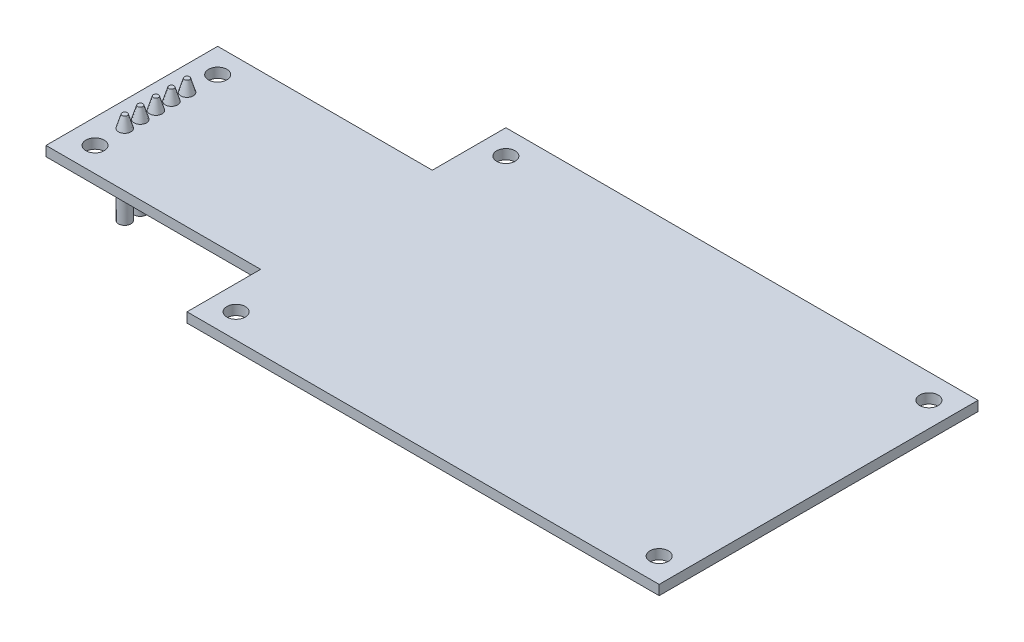
from build123d import *
from OCP.BRepFilletAPI import BRepFilletAPI_MakeChamfer

# Parameters (mm, degrees)
ESQUISSE1_W             = 35
ESQUISSE1_H             = 28
ESQUISSE1_W_2           = 77
ESQUISSE1_H_2           = 52
BOSS_EXTRU_1_DEPTH      = 1.6
ENL_V_MAT_EXTRU_1_REACH = 94.928
ESQUISSE2_R             = 1.5
BOSS_EXTRU_2_DEPTH      = 2
BOSS_EXTRU_2_DEPTH_BACK = 13
ESQUISSE3_R             = 1.016
CHANFREIN1_SIZE         = 2
CHANFREIN1_SIZE_2       = 0.6


with BuildPart() as part:
    # Esquisse1 → Boss.-Extru.1 (new body)
    with BuildSketch(Plane(origin=(0, 0, 0), x_dir=(1, 0, 0), z_dir=(0, 1, 0))):
        with Locations((-17.5, 26)):
            Rectangle(ESQUISSE1_W, ESQUISSE1_H)
        with Locations((38.5, 26)):
            Rectangle(ESQUISSE1_W_2, ESQUISSE1_H_2)
    extrude(amount=BOSS_EXTRU_1_DEPTH)

    # Esquisse2 → Enlèv. mat.-Extru.1 (cut, up to next)
    with BuildSketch(Plane(origin=(0, 1.6, 0), x_dir=(1, 0, 0), z_dir=(0, 1, 0)), mode=Mode.PRIVATE) as enl_v_mat_extru_1_sk1:
        with Locations(Location((-31, 36, 0), (0, 0, 270))):
            Circle(ESQUISSE2_R)
    enl_v_mat_extru_1_tool1 = extrude(enl_v_mat_extru_1_sk1.sketch, amount=-ENL_V_MAT_EXTRU_1_REACH, mode=Mode.PRIVATE) & part.part
    # Esquisse2 → Enlèv. mat.-Extru.1 (cut, up to next)
    with BuildSketch(Plane(origin=(0, 1.6, 0), x_dir=(1, 0, 0), z_dir=(0, 1, 0)), mode=Mode.PRIVATE) as enl_v_mat_extru_1_sk2:
        with Locations(Location((-31, 16, 0), (0, 0, 270))):
            Circle(ESQUISSE2_R)
    enl_v_mat_extru_1_tool2 = extrude(enl_v_mat_extru_1_sk2.sketch, amount=-ENL_V_MAT_EXTRU_1_REACH, mode=Mode.PRIVATE) & part.part
    # Esquisse2 → Enlèv. mat.-Extru.1 (cut, up to next)
    with BuildSketch(Plane(origin=(0, 1.6, 0), x_dir=(1, 0, 0), z_dir=(0, 1, 0)), mode=Mode.PRIVATE) as enl_v_mat_extru_1_sk3:
        with Locations(Location((4, 4, 0), (0, 0, 270))):
            Circle(ESQUISSE2_R)
    enl_v_mat_extru_1_tool3 = extrude(enl_v_mat_extru_1_sk3.sketch, amount=-ENL_V_MAT_EXTRU_1_REACH, mode=Mode.PRIVATE) & part.part
    # Esquisse2 → Enlèv. mat.-Extru.1 (cut, up to next)
    with BuildSketch(Plane(origin=(0, 1.6, 0), x_dir=(1, 0, 0), z_dir=(0, 1, 0)), mode=Mode.PRIVATE) as enl_v_mat_extru_1_sk4:
        with Locations(Location((4, 48, 0), (0, 0, 270))):
            Circle(ESQUISSE2_R)
    enl_v_mat_extru_1_tool4 = extrude(enl_v_mat_extru_1_sk4.sketch, amount=-ENL_V_MAT_EXTRU_1_REACH, mode=Mode.PRIVATE) & part.part
    # Esquisse2 → Enlèv. mat.-Extru.1 (cut, up to next)
    with BuildSketch(Plane(origin=(0, 1.6, 0), x_dir=(1, 0, 0), z_dir=(0, 1, 0)), mode=Mode.PRIVATE) as enl_v_mat_extru_1_sk5:
        with Locations(Location((73, 48, 0), (0, 0, 270))):
            Circle(ESQUISSE2_R)
    enl_v_mat_extru_1_tool5 = extrude(enl_v_mat_extru_1_sk5.sketch, amount=-ENL_V_MAT_EXTRU_1_REACH, mode=Mode.PRIVATE) & part.part
    # Esquisse2 → Enlèv. mat.-Extru.1 (cut, up to next)
    with BuildSketch(Plane(origin=(0, 1.6, 0), x_dir=(1, 0, 0), z_dir=(0, 1, 0)), mode=Mode.PRIVATE) as enl_v_mat_extru_1_sk6:
        with Locations(Location((73, 4, 0), (0, 0, 270))):
            Circle(ESQUISSE2_R)
    enl_v_mat_extru_1_tool6 = extrude(enl_v_mat_extru_1_sk6.sketch, amount=-ENL_V_MAT_EXTRU_1_REACH, mode=Mode.PRIVATE) & part.part
    add(enl_v_mat_extru_1_tool1.solids().sort_by_distance((-31, 1.6, -36))[0], mode=Mode.SUBTRACT)
    add(enl_v_mat_extru_1_tool2.solids().sort_by_distance((-31, 1.6, -16))[0], mode=Mode.SUBTRACT)
    add(enl_v_mat_extru_1_tool3.solids().sort_by_distance((4, 1.6, -4))[0], mode=Mode.SUBTRACT)
    add(enl_v_mat_extru_1_tool4.solids().sort_by_distance((4, 1.6, -48))[0], mode=Mode.SUBTRACT)
    add(enl_v_mat_extru_1_tool5.solids().sort_by_distance((73, 1.6, -48))[0], mode=Mode.SUBTRACT)
    add(enl_v_mat_extru_1_tool6.solids().sort_by_distance((73, 1.6, -4))[0], mode=Mode.SUBTRACT)

    # Esquisse3 → Boss.-Extru.2 (add, two sides: drawn at the far end of the back side and taken through both)
    with BuildSketch(Plane(origin=(0, 1.6, 0), x_dir=(1, 0, 0), z_dir=(0, 1, 0)).offset(-BOSS_EXTRU_2_DEPTH_BACK)):
        with Locations(Location((-31, 31, 0), (0, 0, 270))):
            Circle(ESQUISSE3_R)
        with Locations(Location((-31, 28.46, 0), (0, 0, 270))):
            Circle(ESQUISSE3_R)
        with Locations(Location((-31, 25.92, 0), (0, 0, 270))):
            Circle(ESQUISSE3_R)
        with Locations(Location((-31, 23.38, 0), (0, 0, 270))):
            Circle(ESQUISSE3_R)
        with Locations(Location((-31, 20.84, 0), (0, 0, 270))):
            Circle(ESQUISSE3_R)
    extrude(amount=BOSS_EXTRU_2_DEPTH + BOSS_EXTRU_2_DEPTH_BACK)

    # Chanfrein1
    chanfrein1_edges_1 = [part.edges().sort_by_distance(p)[0] for p in [
        (-31, 3.6, -32.016),
    ]]
    chanfrein1_side_1 = [part.faces().sort_by_distance(p)[0] for p in [
        (-31, 3.588, -32.016),
    ]]
    chanfrein1_edges_2 = [part.edges().sort_by_distance(p)[0] for p in [
        (-31, 3.6, -29.476),
    ]]
    chanfrein1_side_2 = [part.faces().sort_by_distance(p)[0] for p in [
        (-31, 3.588, -29.476),
    ]]
    chanfrein1_edges_3 = [part.edges().sort_by_distance(p)[0] for p in [
        (-31, 3.6, -26.936),
    ]]
    chanfrein1_side_3 = [part.faces().sort_by_distance(p)[0] for p in [
        (-31, 3.588, -26.936),
    ]]
    chanfrein1_edges_4 = [part.edges().sort_by_distance(p)[0] for p in [
        (-31, 3.6, -24.396),
    ]]
    chanfrein1_side_4 = [part.faces().sort_by_distance(p)[0] for p in [
        (-31, 3.588, -24.396),
    ]]
    chanfrein1_edges_5 = [part.edges().sort_by_distance(p)[0] for p in [
        (-31, 3.6, -21.856),
    ]]
    chanfrein1_side_5 = [part.faces().sort_by_distance(p)[0] for p in [
        (-31, 3.588, -21.856),
    ]]
    chanfrein1 = BRepFilletAPI_MakeChamfer(part.part.solid().wrapped)
    for e in chanfrein1_edges_1:
        chanfrein1.Add(CHANFREIN1_SIZE - 0.0001, CHANFREIN1_SIZE_2 - 0.0001, e.wrapped, chanfrein1_side_1[0].wrapped)
    for e in chanfrein1_edges_2:
        chanfrein1.Add(CHANFREIN1_SIZE - 0.0001, CHANFREIN1_SIZE_2 - 0.0001, e.wrapped, chanfrein1_side_2[0].wrapped)
    for e in chanfrein1_edges_3:
        chanfrein1.Add(CHANFREIN1_SIZE - 0.0001, CHANFREIN1_SIZE_2 - 0.0001, e.wrapped, chanfrein1_side_3[0].wrapped)
    for e in chanfrein1_edges_4:
        chanfrein1.Add(CHANFREIN1_SIZE - 0.0001, CHANFREIN1_SIZE_2 - 0.0001, e.wrapped, chanfrein1_side_4[0].wrapped)
    for e in chanfrein1_edges_5:
        chanfrein1.Add(CHANFREIN1_SIZE - 0.0001, CHANFREIN1_SIZE_2 - 0.0001, e.wrapped, chanfrein1_side_5[0].wrapped)
    add(Compound.cast(chanfrein1.Shape()), mode=Mode.REPLACE)  # a hair under: the kernel refuses the full size


solid = part.part
